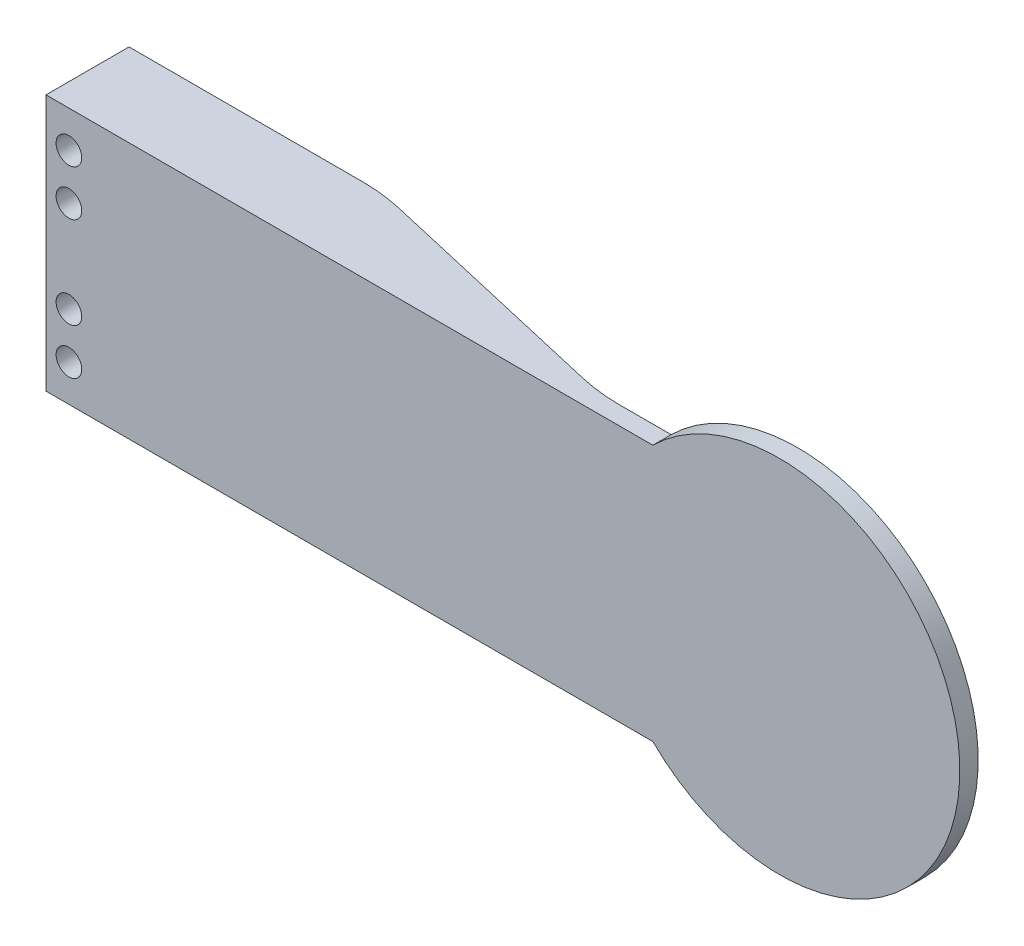
from build123d import *

# Parameters (mm, degrees)
SKETCH1_W           = 15
SKETCH1_H           = 28
BOSS_EXTRUDE1_DEPTH = 9.06
SKETCH2_R           = 1.4
CUT_EXTRUDE1_DEPTH  = 26
SKETCH3_W           = 2
SKETCH3_H           = 28
BOSS_EXTRUDE2_DEPTH = 85
CHAMFER1_SIZE       = 10
CHAMFER1_SIZE_2     = 43.314758743
SKETCH4_R           = 19.675
BOSS_EXTRUDE3_DEPTH = 2
CUT_EXTRUDE3_START  = -2
CUT_EXTRUDE3_DEPTH  = 2
FILLET1_R           = 20


with BuildPart() as part:
    # Sketch1 → Boss-Extrude1 (new body)
    with BuildSketch(Plane.XY):
        with Locations((7.5, 14)):
            Rectangle(SKETCH1_W, SKETCH1_H)
    extrude(amount=BOSS_EXTRUDE1_DEPTH)

    # Sketch2 → Cut-Extrude1 (cut)
    with BuildSketch(Plane.XY.offset(9.06)):
        with Locations((2.5, 24)):
            Circle(SKETCH2_R)
        with Locations((2.5, 19)):
            Circle(SKETCH2_R)
        with Locations((2.5, 9)):
            Circle(SKETCH2_R)
        with Locations((2.5, 4)):
            Circle(SKETCH2_R)
    extrude(amount=-CUT_EXTRUDE1_DEPTH, mode=Mode.SUBTRACT)

    # Sketch3 → Boss-Extrude2 (add)
    with BuildSketch(Plane(origin=(15, 0, 0), x_dir=(0, 0, -1), z_dir=(1, 0, 0))):
        with Locations((-8.06, 14)):
            Rectangle(SKETCH3_W, SKETCH3_H)
    extrude(amount=BOSS_EXTRUDE2_DEPTH)

    # Chamfer1
    # the kernel refuses this chamfer: 43.314758743, 10 mm, written as the material it adds along each edge
    with BuildSketch(Plane(origin=(15, 28, 7.06), x_dir=(-0.16038219639928503, 0, -0.9870549888826565), z_dir=(0, -1, 0))) as chamfer1_piece_1_section:
        Polygon((CHAMFER1_SIZE * 0.987054988883, CHAMFER1_SIZE * 0.160382196399), (-CHAMFER1_SIZE_2 * 0.160382196399, CHAMFER1_SIZE_2 * 0.987054988879), (0, 0), align=None)
    chamfer1_piece_1 = extrude(amount=28, mode=Mode.PRIVATE)
    chamfer1_piece_1 = split(chamfer1_piece_1, bisect_by=Plane(origin=(31.447908445, 14, 0), z_dir=(0, 0, 1)), keep=Keep.TOP, mode=Mode.PRIVATE)
    add(chamfer1_piece_1)

    # Sketch4 → Boss-Extrude3 (add)
    with BuildSketch(Plane.XY.offset(9.06)):
        with Locations((80.035, 14)):
            Circle(SKETCH4_R)
    extrude(amount=-BOSS_EXTRUDE3_DEPTH)

    # Sketch5 → Cut-Extrude3 (cut)
    with BuildSketch(Plane(origin=(0, 0, 7.06), x_dir=(-1, 0, 0), z_dir=(0, 0, -1)).offset(CUT_EXTRUDE3_START)):
        with BuildLine():
            ThreePointArc((-93.859095811, 0), (-99.71, 14), (-93.859095811, 28))
            Line((-93.859095811, 28), (-100, 28))
            Line((-100, 28), (-100, 0))
            Line((-100, 0), (-93.859095811, 0))
        make_face()
    extrude(amount=CUT_EXTRUDE3_DEPTH, mode=Mode.SUBTRACT)

    # Fillet1
    fillet1_edges = [part.edges().sort_by_distance(p)[0] for p in [
        (58.314758743, 14, 7.06),
        (27.73453907, 14, 0),
    ]]
    fillet(fillet1_edges, radius=FILLET1_R)


solid = part.part
